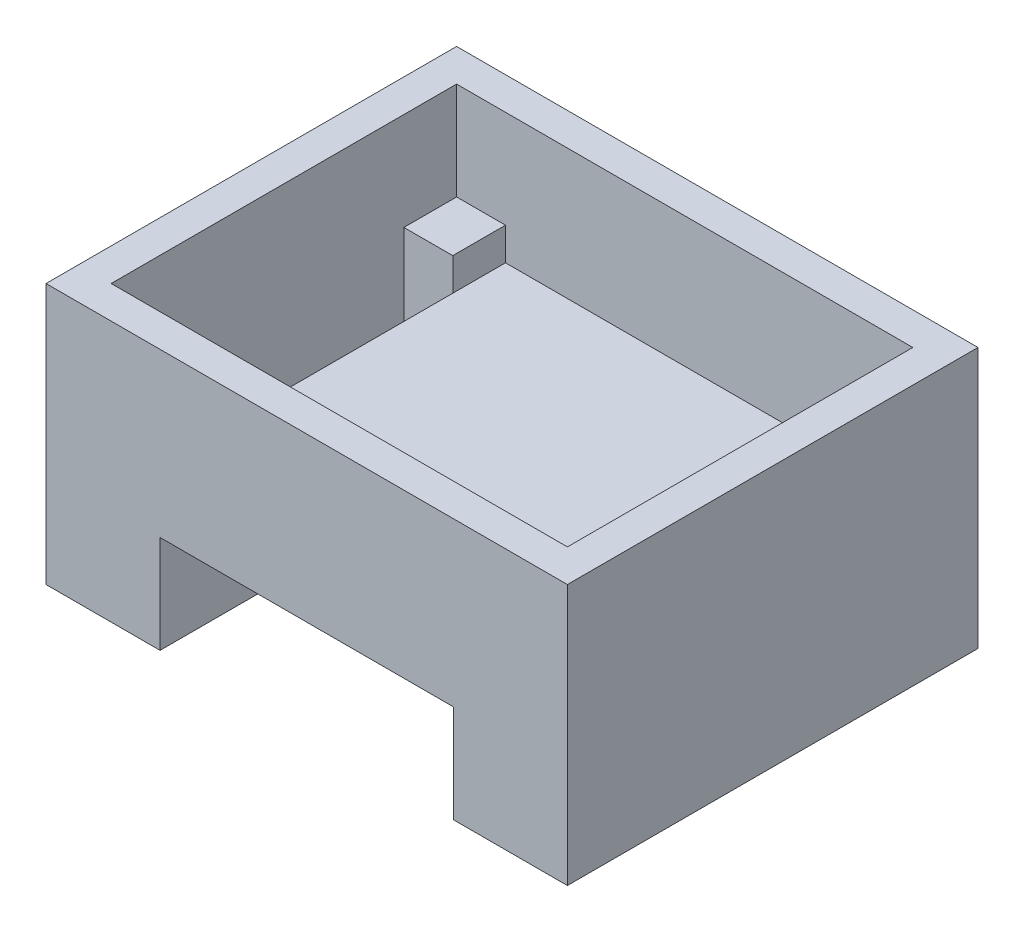
from build123d import *

# Parameters (mm, degrees)
SKETCH1_W           = 160
SKETCH1_H           = 80
BOSS_EXTRUDE1_DEPTH = 126
SKETCH2_W           = 90
SKETCH2_H           = 60
CUT_EXTRUDE1_DEPTH  = 126
SKETCH3_R           = 5
CUT_EXTRUDE2_DEPTH  = 40
SHELL1_DEPTH        = 40
SHELL1_START        = -30
SHELL1_2_DEPTH      = 30
SHELL1_START_2      = 10
SHELL1_3_DEPTH      = 30
SKETCH4_W           = 110
SKETCH4_H           = 106
CUT_EXTRUDE3_DEPTH  = 10
SKETCH5_W           = 15
SKETCH5_H           = 73.639320226
CUT_EXTRUDE4_DEPTH  = 40


# Read off the part's stored shape, not the designer's step: Shell1
with BuildPart() as part:
    # Sketch1 → Boss-Extrude1 (new body)
    with BuildSketch(Plane.XY):
        Rectangle(SKETCH1_W, SKETCH1_H)
    extrude(amount=-BOSS_EXTRUDE1_DEPTH)

    # Sketch2 → Cut-Extrude1 (cut)
    with BuildSketch(Plane.XY):
        with Locations((0, -40)):
            Rectangle(SKETCH2_W, SKETCH2_H)
    extrude(amount=-CUT_EXTRUDE1_DEPTH, mode=Mode.SUBTRACT)

    # Sketch3 → Cut-Extrude2 (cut)
    with BuildSketch(Plane.XZ.offset(40)):
        with Locations(Location((-65, -15, 0), (0, 0, 270))):
            Circle(SKETCH3_R)
        with Locations(Location((65, -15, 0), (0, 0, 90))):
            Circle(SKETCH3_R)
        with Locations(Location((65, -111, 0), (0, 0, 270))):
            Circle(SKETCH3_R)
        with Locations(Location((-65, -111, 0), (0, 0, 90))):
            Circle(SKETCH3_R)
    extrude(amount=-CUT_EXTRUDE2_DEPTH, mode=Mode.SUBTRACT)

    # Shell1 outline → Shell1 (cut)
    with BuildSketch(Plane(origin=(0, 0, 0), x_dir=(1, 0, 0), z_dir=(0, 1, 0))):
        with BuildLine():
            Line((70, 29.142135624), (70, 96.857864376))
            ThreePointArc((70, 96.857864376), (54.393398282, 100.393398282), (50.857864376, 116))
            Line((50.857864376, 116), (-50.857864376, 116))
            ThreePointArc((-50.857864376, 116), (-54.393398282, 100.393398282), (-70, 96.857864376))
            Line((-70, 96.857864376), (-70, 29.142135624))
            ThreePointArc((-70, 29.142135624), (-54.393398282, 25.606601718), (-50.857864376, 10))
            Line((-50.857864376, 10), (50.857864376, 10))
            ThreePointArc((50.857864376, 10), (54.393398282, 25.606601718), (70, 29.142135624))
        make_face()
    extrude(amount=SHELL1_DEPTH, mode=Mode.SUBTRACT)

    # Shell1 2 outline → Shell1 2 (cut)
    with BuildSketch(Plane(origin=(0, 0, 0), x_dir=(1, 0, 0), z_dir=(0, 1, 0)).offset(SHELL1_START)):
        with BuildLine():
            ThreePointArc((55, 26.180339887), (62.094305849, 29.715873794), (70, 29.142135624))
            Line((70, 29.142135624), (70, 96.857864376))
            ThreePointArc((70, 96.857864376), (62.094305849, 96.284126206), (55, 99.819660113))
            Line((55, 99.819660113), (55, 26.180339887))
        make_face()
        with BuildLine():
            ThreePointArc((-70, 29.142135624), (-62.094305849, 29.715873794), (-55, 26.180339887))
            Line((-55, 26.180339887), (-55, 99.819660113))
            ThreePointArc((-55, 99.819660113), (-62.094305849, 96.284126206), (-70, 96.857864376))
            Line((-70, 96.857864376), (-70, 29.142135624))
        make_face()
    extrude(amount=SHELL1_2_DEPTH, mode=Mode.SUBTRACT)

    # Shell1 3 outline → Shell1 3 (cut)
    with BuildSketch(Plane(origin=(0, 0, 0), x_dir=(1, 0, 0), z_dir=(0, 1, 0)).offset(SHELL1_START_2)):
        with BuildLine():
            Line((50.857864376, 10), (70, 10))
            Line((70, 10), (70, 29.142135624))
            ThreePointArc((70, 29.142135624), (54.393398282, 25.606601718), (50.857864376, 10))
        make_face()
        with BuildLine():
            ThreePointArc((50.857864376, 116), (54.393398282, 100.393398282), (70, 96.857864376))
            Line((70, 96.857864376), (70, 116))
            Line((70, 116), (50.857864376, 116))
        make_face()
        with BuildLine():
            Line((-70, 10), (-50.857864376, 10))
            ThreePointArc((-50.857864376, 10), (-54.393398282, 25.606601718), (-70, 29.142135624))
            Line((-70, 29.142135624), (-70, 10))
        make_face()
        with BuildLine():
            ThreePointArc((-70, 96.857864376), (-54.393398282, 100.393398282), (-50.857864376, 116))
            Line((-50.857864376, 116), (-70, 116))
            Line((-70, 116), (-70, 96.857864376))
        make_face()
    extrude(amount=SHELL1_3_DEPTH, mode=Mode.SUBTRACT)

    # Sketch4 → Cut-Extrude3 (cut)
    with BuildSketch(Plane(origin=(0, 0, 0), x_dir=(1, 0, 0), z_dir=(0, 1, 0))):
        with Locations((0, 63)):
            Rectangle(SKETCH4_W, SKETCH4_H)
    extrude(amount=CUT_EXTRUDE3_DEPTH, mode=Mode.SUBTRACT)

    # Sketch5 → Cut-Extrude4 (cut)
    with BuildSketch(Plane(origin=(0, -30, 0), x_dir=(1, 0, 0), z_dir=(0, 1, 0))):
        with Locations((-62.5, 63)):
            Rectangle(SKETCH5_W, SKETCH5_H)
    cut_extrude4 = extrude(amount=CUT_EXTRUDE4_DEPTH, mode=Mode.SUBTRACT)

    # Mirror1: Cut-Extrude4 across plane
    add(cut_extrude4.mirror(Plane(origin=(0, 0, 0), x_dir=(0, 0, 1), z_dir=(1, 0, 0))), mode=Mode.SUBTRACT)


solid = part.part
